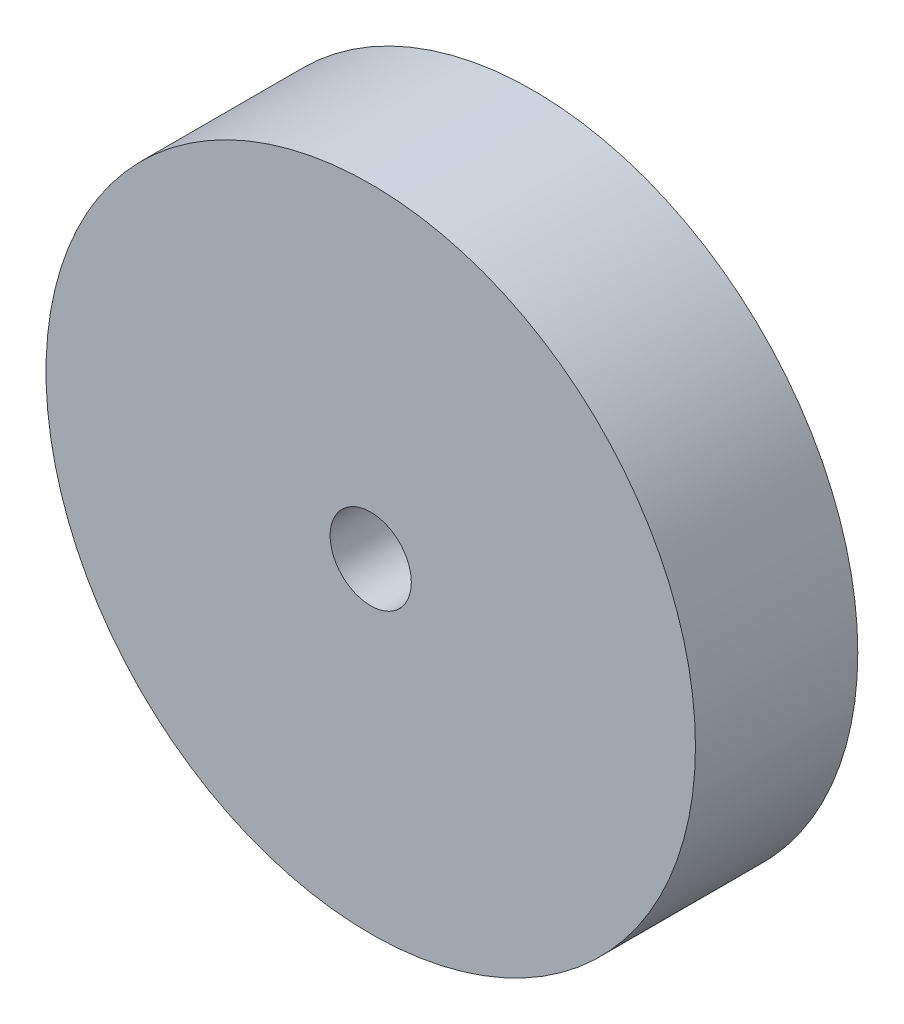
from build123d import *

# Parameters (mm, degrees)
SKETCH3_R   = 25.4
SKETCH3_R_2 = 3.175
BASE_DEPTH  = 12.7


with BuildPart() as part:
    # Sketch3 → base (new body)
    with BuildSketch(Plane(origin=(0, 0, 0), x_dir=(0, 1, 0), z_dir=(0, 0, 1))):
        Circle(SKETCH3_R)
        Circle(SKETCH3_R_2, mode=Mode.SUBTRACT)
    extrude(amount=BASE_DEPTH)


solid = part.part
